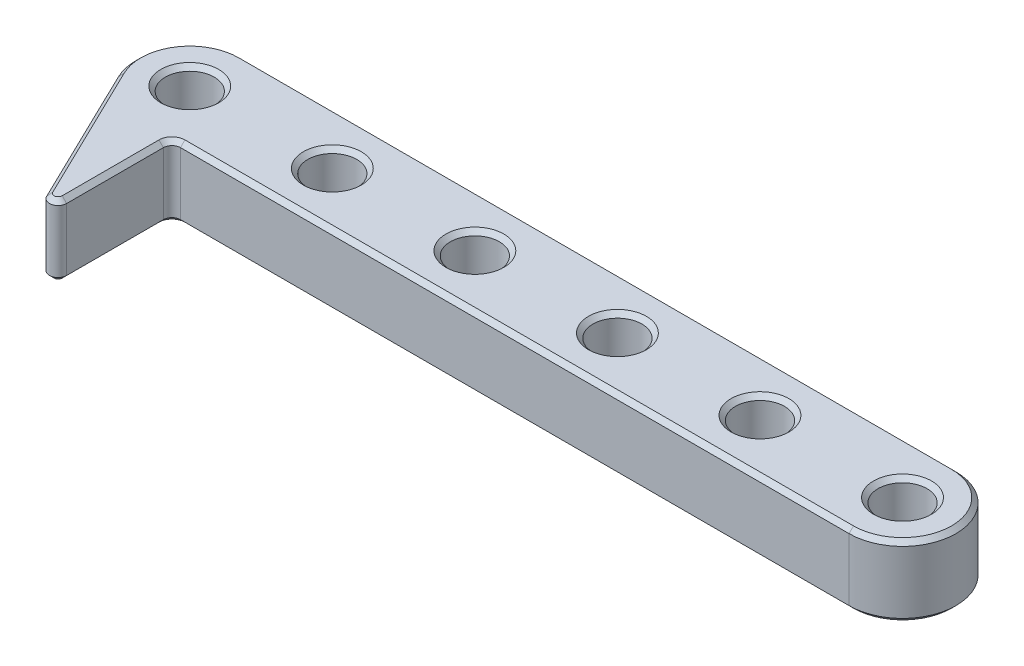
from build123d import *

# Parameters (mm, degrees)
SKETCH1_R           = 2.1828125
BOSS_EXTRUDE1_DEPTH = 6.35
CHAMFER1_SIZE       = 0.396875


with BuildPart() as part:
    # Sketch1 → Boss-Extrude1 (new body)
    with BuildSketch(Plane(origin=(0, 0, 0), x_dir=(1, 0, 0), z_dir=(0, 1, 0))):
        with BuildLine():
            Line((-63.5, 4.7625), (0, 4.7625))
            ThreePointArc((0, 4.7625), (4.7625, 0), (0, -4.7625))
            Line((0, -4.7625), (-59.563, -4.7625))
            ThreePointArc((-59.563, -4.7625), (-60.101815367, -4.985684633), (-60.325, -5.5245))
            Line((-60.325, -5.5245), (-60.325, -14.144701767))
            ThreePointArc((-60.325, -14.144701767), (-60.91643196, -14.887366256), (-61.772639223, -14.477181625))
            Line((-61.772639223, -14.477181625), (-67.785245141, -2.077999117))
            ThreePointArc((-67.785245141, -2.077999117), (-67.535955714, 2.528332994), (-63.5, 4.7625))
        make_face()
        Circle(SKETCH1_R, mode=Mode.SUBTRACT)
        with Locations((-63.5, 0)):
            Circle(SKETCH1_R, mode=Mode.SUBTRACT)
        with Locations((-12.7, 0)):
            Circle(SKETCH1_R, mode=Mode.SUBTRACT)
        with Locations((-50.8, 0)):
            Circle(SKETCH1_R, mode=Mode.SUBTRACT)
        with Locations((-25.4, 0)):
            Circle(SKETCH1_R, mode=Mode.SUBTRACT)
        with Locations((-38.1, 0)):
            Circle(SKETCH1_R, mode=Mode.SUBTRACT)
    extrude(amount=BOSS_EXTRUDE1_DEPTH)

    # Chamfer1
    chamfer1_edges = [part.edges().sort_by_distance(p)[0] for p in [
        (-52.9828125, 0, 0),
        (-14.8828125, 0, 0),
        (-65.6828125, 0, 0),
        (-2.1828125, 0, 0),
        (-64.778942182, 0, 8.277590371),
        (-60.91643196, 0, 14.887366256),
        (-60.325, 0, 9.834600883),
        (-60.101815367, 0, 4.985684633),
        (-29.7815, 0, 4.7625),
        (4.7625, 0, 0),
        (-31.75, 0, -4.7625),
        (-67.535955714, 0, -2.528332994),
        (-52.9828125, 6.35, 0),
        (-65.6828125, 6.35, 0),
        (-31.75, 6.35, -4.7625),
        (4.7625, 6.35, 0),
        (-29.7815, 6.35, 4.7625),
        (-60.101815367, 6.35, 4.985684633),
        (-60.325, 6.35, 9.834600883),
        (-60.91643196, 6.35, 14.887366256),
        (-64.778942182, 6.35, 8.277590371),
        (-67.535955714, 6.35, -2.528332994),
        (-2.1828125, 6.35, 0),
        (-14.8828125, 6.35, 0),
        (-27.5828125, 0, 0),
        (-40.2828125, 0, 0),
        (-27.5828125, 6.35, 0),
        (-40.2828125, 6.35, 0),
    ]]
    chamfer(chamfer1_edges, length=CHAMFER1_SIZE)


solid = part.part
